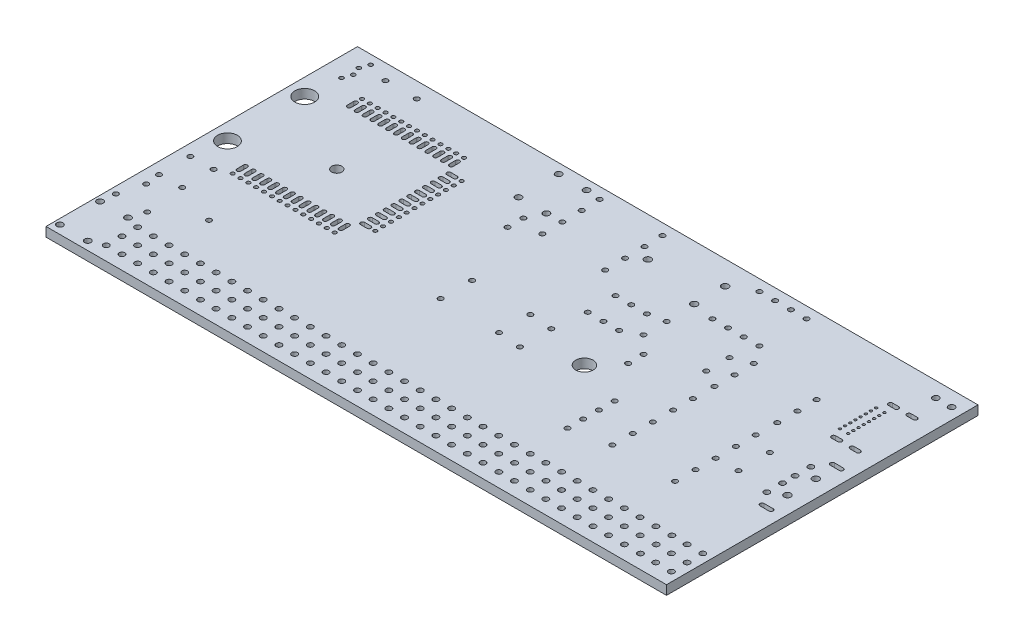
from build123d import *

# Parameters (mm, degrees)
SKETCH1_W           = 100.4
SKETCH1_H           = 50.4
SKETCH1_R           = 1.592180998
SKETCH1_R_2         = 0.203
SKETCH1_R_3         = 0.45
SKETCH1_R_4         = 0.546
SKETCH1_R_5         = 0.406
SKETCH1_R_6         = 1.4
SKETCH1_R_7         = 0.457
SKETCH1_R_8         = 0.508
SKETCH1_R_9         = 0.3
SKETCH1_R_10        = 0.325
SKETCH1_R_11        = 0.82
SKETCH1_R_12        = 0.5
SKETCH1_R_13        = 1.59227426
BOSS_EXTRUDE1_DEPTH = 1.5


with BuildPart() as part:
    # Sketch1 → Boss-Extrude1 (new body)
    with BuildSketch(Plane(origin=(0, 0, 0), x_dir=(1, 0, 0), z_dir=(0, 1, 0))):
        with Locations((51.575, 25.508)):
            Rectangle(SKETCH1_W, SKETCH1_H)
        with Locations((4.091913116, 39.45416383)):
            Circle(SKETCH1_R, mode=Mode.SUBTRACT)
        with Locations((95.301, 42.05)):
            Circle(SKETCH1_R_2, mode=Mode.SUBTRACT)
        with Locations((95.301, 41.212)):
            Circle(SKETCH1_R_2, mode=Mode.SUBTRACT)
        with Locations((95.301, 38.697)):
            Circle(SKETCH1_R_2, mode=Mode.SUBTRACT)
        with Locations((95.301, 37.859)):
            Circle(SKETCH1_R_2, mode=Mode.SUBTRACT)
        with Locations((95.301, 40.373)):
            Circle(SKETCH1_R_2, mode=Mode.SUBTRACT)
        with Locations((95.301, 39.535)):
            Circle(SKETCH1_R_2, mode=Mode.SUBTRACT)
        with Locations((93.955, 42.05)):
            Circle(SKETCH1_R_2, mode=Mode.SUBTRACT)
        with Locations((93.955, 41.212)):
            Circle(SKETCH1_R_2, mode=Mode.SUBTRACT)
        with Locations((93.955, 40.373)):
            Circle(SKETCH1_R_2, mode=Mode.SUBTRACT)
        with Locations((93.955, 37.859)):
            Circle(SKETCH1_R_2, mode=Mode.SUBTRACT)
        with Locations((93.955, 37.02)):
            Circle(SKETCH1_R_2, mode=Mode.SUBTRACT)
        with Locations((93.955, 39.535)):
            Circle(SKETCH1_R_2, mode=Mode.SUBTRACT)
        with Locations((93.955, 38.697)):
            Circle(SKETCH1_R_2, mode=Mode.SUBTRACT)
        with Locations((96.926, 28.499)):
            Circle(SKETCH1_R_3, mode=Mode.SUBTRACT)
        with Locations((95.301, 37.02)):
            Circle(SKETCH1_R_2, mode=Mode.SUBTRACT)
        with Locations((95.301, 36.182)):
            Circle(SKETCH1_R_2, mode=Mode.SUBTRACT)
        with Locations((99.009, 27.229)):
            Circle(SKETCH1_R_4, mode=Mode.SUBTRACT)
        with Locations((99.009, 22.644)):
            Circle(SKETCH1_R_4, mode=Mode.SUBTRACT)
        with Locations((96.926, 25.959)):
            Circle(SKETCH1_R_3, mode=Mode.SUBTRACT)
        with Locations((96.926, 23.927)):
            Circle(SKETCH1_R_3, mode=Mode.SUBTRACT)
        with Locations((93.955, 36.182)):
            Circle(SKETCH1_R_2, mode=Mode.SUBTRACT)
        with Locations((88.036, 35.23)):
            Circle(SKETCH1_R_5, mode=Mode.SUBTRACT)
        with Locations((88.034, 31.965)):
            Circle(SKETCH1_R_5, mode=Mode.SUBTRACT)
        with Locations((91.618, 27.178)):
            Circle(SKETCH1_R_5, mode=Mode.SUBTRACT)
        with Locations((91.618, 22.098)):
            Circle(SKETCH1_R_5, mode=Mode.SUBTRACT)
        with Locations((88.011, 25.298)):
            Circle(SKETCH1_R_5, mode=Mode.SUBTRACT)
        with Locations((88.036, 22.003)):
            Circle(SKETCH1_R_5, mode=Mode.SUBTRACT)
        with Locations((75.844, 48.895)):
            Circle(SKETCH1_R_5, mode=Mode.SUBTRACT)
        with Locations((73.304, 48.895)):
            Circle(SKETCH1_R_5, mode=Mode.SUBTRACT)
        with Locations((75.844, 41.275)):
            Circle(SKETCH1_R_5, mode=Mode.SUBTRACT)
        with Locations((70.764, 48.895)):
            Circle(SKETCH1_R_5, mode=Mode.SUBTRACT)
        with Locations((70.764, 41.275)):
            Circle(SKETCH1_R_5, mode=Mode.SUBTRACT)
        with Locations((77.826, 38.379)):
            Circle(SKETCH1_R_5, mode=Mode.SUBTRACT)
        with Locations((87.986, 38.379)):
            Circle(SKETCH1_R_5, mode=Mode.SUBTRACT)
        with Locations((73.304, 41.275)):
            Circle(SKETCH1_R_5, mode=Mode.SUBTRACT)
        with Locations((75.057, 37.211)):
            Circle(SKETCH1_R_5, mode=Mode.SUBTRACT)
        with Locations((68.224, 48.895)):
            Circle(SKETCH1_R_5, mode=Mode.SUBTRACT)
        with Locations((64.7, 46.874)):
            Circle(SKETCH1_R_4, mode=Mode.SUBTRACT)
        with Locations((54.69, 44.374)):
            Circle(SKETCH1_R_4, mode=Mode.SUBTRACT)
        with Locations((64.68, 41.874)):
            Circle(SKETCH1_R_4, mode=Mode.SUBTRACT)
        with Locations((68.224, 41.275)):
            Circle(SKETCH1_R_5, mode=Mode.SUBTRACT)
        with Locations((64.897, 37.211)):
            Circle(SKETCH1_R_5, mode=Mode.SUBTRACT)
        with Locations((59.69, 36.678)):
            Circle(SKETCH1_R_5, mode=Mode.SUBTRACT)
        with Locations((62.23, 36.678)):
            Circle(SKETCH1_R_5, mode=Mode.SUBTRACT)
        with Locations((77.876, 35.23)):
            Circle(SKETCH1_R_5, mode=Mode.SUBTRACT)
        with Locations((77.874, 31.965)):
            Circle(SKETCH1_R_5, mode=Mode.SUBTRACT)
        with Locations((88.001, 28.512)):
            Circle(SKETCH1_R_5, mode=Mode.SUBTRACT)
        with Locations((75.057, 33.452)):
            Circle(SKETCH1_R_5, mode=Mode.SUBTRACT)
        with Locations((77.841, 28.512)):
            Circle(SKETCH1_R_5, mode=Mode.SUBTRACT)
        with Locations((77.851, 25.298)):
            Circle(SKETCH1_R_5, mode=Mode.SUBTRACT)
        with Locations((77.876, 22.003)):
            Circle(SKETCH1_R_5, mode=Mode.SUBTRACT)
        with Locations((67.666, 28.194)):
            Circle(SKETCH1_R_5, mode=Mode.SUBTRACT)
        with Locations((71.832, 21.846)):
            Circle(SKETCH1_R_5, mode=Mode.SUBTRACT)
        with Locations((64.897, 33.452)):
            Circle(SKETCH1_R_5, mode=Mode.SUBTRACT)
        with Locations((62.306, 32.106)):
            Circle(SKETCH1_R_5, mode=Mode.SUBTRACT)
        with Locations((57.15, 36.678)):
            Circle(SKETCH1_R_5, mode=Mode.SUBTRACT)
        with Locations((59.766, 32.106)):
            Circle(SKETCH1_R_5, mode=Mode.SUBTRACT)
        with Locations((67.64, 30.734)):
            Circle(SKETCH1_R_5, mode=Mode.SUBTRACT)
        with Locations((64.364, 24.435)):
            Circle(SKETCH1_R_6, mode=Mode.SUBTRACT)
        with Locations((57.226, 32.106)):
            Circle(SKETCH1_R_5, mode=Mode.SUBTRACT)
        with Locations((56.591, 26.848)):
            Circle(SKETCH1_R_5, mode=Mode.SUBTRACT)
        with Locations((96.926, 21.387)):
            Circle(SKETCH1_R_3, mode=Mode.SUBTRACT)
        with Locations((95.301, 7.645)):
            Circle(SKETCH1_R_7, mode=Mode.SUBTRACT)
        with Locations((88.011, 18.771)):
            Circle(SKETCH1_R_5, mode=Mode.SUBTRACT)
        with Locations((90.17, 7.62)):
            Circle(SKETCH1_R_7, mode=Mode.SUBTRACT)
        with Locations((97.79, 7.62)):
            Circle(SKETCH1_R_7, mode=Mode.SUBTRACT)
        with Locations((100.33, 7.62)):
            Circle(SKETCH1_R_7, mode=Mode.SUBTRACT)
        with Locations((92.735, 7.62)):
            Circle(SKETCH1_R_7, mode=Mode.SUBTRACT)
        with Locations((95.301, 5.105)):
            Circle(SKETCH1_R_7, mode=Mode.SUBTRACT)
        with Locations((77.851, 18.771)):
            Circle(SKETCH1_R_5, mode=Mode.SUBTRACT)
        with Locations((87.981, 15.489)):
            Circle(SKETCH1_R_5, mode=Mode.SUBTRACT)
        with Locations((77.821, 15.489)):
            Circle(SKETCH1_R_5, mode=Mode.SUBTRACT)
        with Locations((77.47, 7.645)):
            Circle(SKETCH1_R_7, mode=Mode.SUBTRACT)
        with Locations((85.09, 7.62)):
            Circle(SKETCH1_R_7, mode=Mode.SUBTRACT)
        with Locations((87.63, 7.62)):
            Circle(SKETCH1_R_7, mode=Mode.SUBTRACT)
        with Locations((80.01, 7.62)):
            Circle(SKETCH1_R_7, mode=Mode.SUBTRACT)
        with Locations((82.55, 7.62)):
            Circle(SKETCH1_R_7, mode=Mode.SUBTRACT)
        with Locations((100.33, 5.08)):
            Circle(SKETCH1_R_7, mode=Mode.SUBTRACT)
        with Locations((97.79, 5.08)):
            Circle(SKETCH1_R_7, mode=Mode.SUBTRACT)
        with Locations((95.301, 2.565)):
            Circle(SKETCH1_R_7, mode=Mode.SUBTRACT)
        with Locations((90.17, 5.08)):
            Circle(SKETCH1_R_7, mode=Mode.SUBTRACT)
        with Locations((92.735, 5.08)):
            Circle(SKETCH1_R_7, mode=Mode.SUBTRACT)
        with Locations((97.79, 2.54)):
            Circle(SKETCH1_R_7, mode=Mode.SUBTRACT)
        with Locations((100.33, 2.54)):
            Circle(SKETCH1_R_7, mode=Mode.SUBTRACT)
        with Locations((90.17, 2.54)):
            Circle(SKETCH1_R_7, mode=Mode.SUBTRACT)
        with Locations((92.735, 2.54)):
            Circle(SKETCH1_R_7, mode=Mode.SUBTRACT)
        with Locations((85.09, 5.08)):
            Circle(SKETCH1_R_7, mode=Mode.SUBTRACT)
        with Locations((87.63, 5.08)):
            Circle(SKETCH1_R_7, mode=Mode.SUBTRACT)
        with Locations((80.01, 5.08)):
            Circle(SKETCH1_R_7, mode=Mode.SUBTRACT)
        with Locations((82.55, 5.08)):
            Circle(SKETCH1_R_7, mode=Mode.SUBTRACT)
        with Locations((85.09, 2.54)):
            Circle(SKETCH1_R_7, mode=Mode.SUBTRACT)
        with Locations((87.63, 2.54)):
            Circle(SKETCH1_R_7, mode=Mode.SUBTRACT)
        with Locations((80.01, 2.54)):
            Circle(SKETCH1_R_7, mode=Mode.SUBTRACT)
        with Locations((82.55, 2.54)):
            Circle(SKETCH1_R_7, mode=Mode.SUBTRACT)
        with Locations((72.415, 7.62)):
            Circle(SKETCH1_R_7, mode=Mode.SUBTRACT)
        with Locations((71.832, 14.226)):
            Circle(SKETCH1_R_5, mode=Mode.SUBTRACT)
        with Locations((74.93, 7.62)):
            Circle(SKETCH1_R_7, mode=Mode.SUBTRACT)
        with Locations((71.832, 19.306)):
            Circle(SKETCH1_R_5, mode=Mode.SUBTRACT)
        with Locations((71.832, 16.766)):
            Circle(SKETCH1_R_5, mode=Mode.SUBTRACT)
        with Locations((77.47, 5.105)):
            Circle(SKETCH1_R_7, mode=Mode.SUBTRACT)
        with Locations((72.415, 5.08)):
            Circle(SKETCH1_R_7, mode=Mode.SUBTRACT)
        with Locations((69.85, 7.62)):
            Circle(SKETCH1_R_7, mode=Mode.SUBTRACT)
        with Locations((69.85, 5.08)):
            Circle(SKETCH1_R_7, mode=Mode.SUBTRACT)
        with Locations((64.77, 7.62)):
            Circle(SKETCH1_R_7, mode=Mode.SUBTRACT)
        with Locations((67.31, 7.62)):
            Circle(SKETCH1_R_7, mode=Mode.SUBTRACT)
        with Locations((56.591, 21.768)):
            Circle(SKETCH1_R_5, mode=Mode.SUBTRACT)
        with Locations((62.23, 7.62)):
            Circle(SKETCH1_R_7, mode=Mode.SUBTRACT)
        with Locations((59.69, 7.62)):
            Circle(SKETCH1_R_7, mode=Mode.SUBTRACT)
        with Locations((67.31, 5.08)):
            Circle(SKETCH1_R_7, mode=Mode.SUBTRACT)
        with Locations((54.61, 7.62)):
            Circle(SKETCH1_R_7, mode=Mode.SUBTRACT)
        with Locations((57.15, 7.62)):
            Circle(SKETCH1_R_7, mode=Mode.SUBTRACT)
        with Locations((74.93, 5.08)):
            Circle(SKETCH1_R_7, mode=Mode.SUBTRACT)
        with Locations((77.47, 2.565)):
            Circle(SKETCH1_R_7, mode=Mode.SUBTRACT)
        with Locations((64.77, 5.08)):
            Circle(SKETCH1_R_7, mode=Mode.SUBTRACT)
        with Locations((74.93, 2.54)):
            Circle(SKETCH1_R_7, mode=Mode.SUBTRACT)
        with Locations((69.85, 2.54)):
            Circle(SKETCH1_R_7, mode=Mode.SUBTRACT)
        with Locations((72.415, 2.54)):
            Circle(SKETCH1_R_7, mode=Mode.SUBTRACT)
        with Locations((64.77, 2.54)):
            Circle(SKETCH1_R_7, mode=Mode.SUBTRACT)
        with Locations((67.31, 2.54)):
            Circle(SKETCH1_R_7, mode=Mode.SUBTRACT)
        with Locations((59.69, 5.08)):
            Circle(SKETCH1_R_7, mode=Mode.SUBTRACT)
        with Locations((62.23, 5.08)):
            Circle(SKETCH1_R_7, mode=Mode.SUBTRACT)
        with Locations((54.61, 5.08)):
            Circle(SKETCH1_R_7, mode=Mode.SUBTRACT)
        with Locations((57.15, 5.08)):
            Circle(SKETCH1_R_7, mode=Mode.SUBTRACT)
        with Locations((59.69, 2.54)):
            Circle(SKETCH1_R_7, mode=Mode.SUBTRACT)
        with Locations((62.23, 2.54)):
            Circle(SKETCH1_R_7, mode=Mode.SUBTRACT)
        with Locations((54.61, 2.54)):
            Circle(SKETCH1_R_7, mode=Mode.SUBTRACT)
        with Locations((57.15, 2.54)):
            Circle(SKETCH1_R_7, mode=Mode.SUBTRACT)
        with Locations((52.629, 45.898)):
            Circle(SKETCH1_R_5, mode=Mode.SUBTRACT)
        with Locations((52.527, 48.895)):
            Circle(SKETCH1_R_5, mode=Mode.SUBTRACT)
        with Locations((42.469, 45.898)):
            Circle(SKETCH1_R_5, mode=Mode.SUBTRACT)
        with Locations((40.03, 49.124)):
            Circle(SKETCH1_R_8, mode=Mode.SUBTRACT)
        with Locations((42.367, 48.895)):
            Circle(SKETCH1_R_5, mode=Mode.SUBTRACT)
        with Locations((52.68, 42.697)):
            Circle(SKETCH1_R_5, mode=Mode.SUBTRACT)
        with Locations((52.73, 39.421)):
            Circle(SKETCH1_R_5, mode=Mode.SUBTRACT)
        with Locations((42.52, 42.697)):
            Circle(SKETCH1_R_5, mode=Mode.SUBTRACT)
        with Locations((42.57, 39.421)):
            Circle(SKETCH1_R_5, mode=Mode.SUBTRACT)
        with Locations((35.509, 49.124)):
            Circle(SKETCH1_R_8, mode=Mode.SUBTRACT)
        with Locations((40.03, 42.621)):
            Circle(SKETCH1_R_8, mode=Mode.SUBTRACT)
        with Locations((24.311, 43.739)):
            Circle(SKETCH1_R_9, mode=Mode.SUBTRACT)
        with Locations((25.581, 43.739)):
            Circle(SKETCH1_R_9, mode=Mode.SUBTRACT)
        with Locations((35.509, 42.621)):
            Circle(SKETCH1_R_8, mode=Mode.SUBTRACT)
        with Locations((38.837, 40.081)):
            Circle(SKETCH1_R_5, mode=Mode.SUBTRACT)
        with Locations((28.626, 40.304)):
            Circle(SKETCH1_R_9, mode=Mode.SUBTRACT)
        with Locations((28.626, 39.034)):
            Circle(SKETCH1_R_9, mode=Mode.SUBTRACT)
        with Locations((38.837, 37.541)):
            Circle(SKETCH1_R_5, mode=Mode.SUBTRACT)
        with Locations((28.626, 36.494)):
            Circle(SKETCH1_R_9, mode=Mode.SUBTRACT)
        with Locations((28.626, 35.224)):
            Circle(SKETCH1_R_9, mode=Mode.SUBTRACT)
        with Locations((28.626, 33.954)):
            Circle(SKETCH1_R_9, mode=Mode.SUBTRACT)
        with Locations((28.626, 32.684)):
            Circle(SKETCH1_R_9, mode=Mode.SUBTRACT)
        with Locations((43.409, 27.203)):
            Circle(SKETCH1_R_5, mode=Mode.SUBTRACT)
        with Locations((52.908, 27.153)):
            Circle(SKETCH1_R_5, mode=Mode.SUBTRACT)
        with Locations((28.626, 31.414)):
            Circle(SKETCH1_R_9, mode=Mode.SUBTRACT)
        with Locations((43.409, 22.123)):
            Circle(SKETCH1_R_5, mode=Mode.SUBTRACT)
        with Locations((28.626, 28.874)):
            Circle(SKETCH1_R_9, mode=Mode.SUBTRACT)
        with Locations((28.626, 27.604)):
            Circle(SKETCH1_R_9, mode=Mode.SUBTRACT)
        with Locations((28.626, 37.764)):
            Circle(SKETCH1_R_9, mode=Mode.SUBTRACT)
        with Locations((28.626, 30.144)):
            Circle(SKETCH1_R_9, mode=Mode.SUBTRACT)
        with Locations((28.626, 26.334)):
            Circle(SKETCH1_R_9, mode=Mode.SUBTRACT)
        with Locations((25.581, 22.809)):
            Circle(SKETCH1_R_9, mode=Mode.SUBTRACT)
        with Locations((23.041, 22.809)):
            Circle(SKETCH1_R_9, mode=Mode.SUBTRACT)
        with Locations((24.311, 22.809)):
            Circle(SKETCH1_R_9, mode=Mode.SUBTRACT)
        with Locations((16.691, 43.739)):
            Circle(SKETCH1_R_9, mode=Mode.SUBTRACT)
        with Locations((15.421, 43.739)):
            Circle(SKETCH1_R_9, mode=Mode.SUBTRACT)
        with Locations((17.961, 43.739)):
            Circle(SKETCH1_R_9, mode=Mode.SUBTRACT)
        with Locations((13.487, 48.184)):
            Circle(SKETCH1_R_5, mode=Mode.SUBTRACT)
        with Locations((14.151, 43.739)):
            Circle(SKETCH1_R_9, mode=Mode.SUBTRACT)
        with Locations((21.771, 43.739)):
            Circle(SKETCH1_R_9, mode=Mode.SUBTRACT)
        with Locations((23.041, 43.739)):
            Circle(SKETCH1_R_9, mode=Mode.SUBTRACT)
        with Locations((19.231, 43.739)):
            Circle(SKETCH1_R_9, mode=Mode.SUBTRACT)
        with Locations((20.501, 43.739)):
            Circle(SKETCH1_R_9, mode=Mode.SUBTRACT)
        with Locations((4.98, 49.219)):
            Circle(SKETCH1_R_10, mode=Mode.SUBTRACT)
        with Locations((8.407, 48.184)):
            Circle(SKETCH1_R_5, mode=Mode.SUBTRACT)
        with Locations((4.472, 47.822)):
            Circle(SKETCH1_R_10, mode=Mode.SUBTRACT)
        with Locations((4.98, 46.425)):
            Circle(SKETCH1_R_10, mode=Mode.SUBTRACT)
        with Locations((11.611, 43.739)):
            Circle(SKETCH1_R_9, mode=Mode.SUBTRACT)
        with Locations((12.881, 43.739)):
            Circle(SKETCH1_R_9, mode=Mode.SUBTRACT)
        with Locations((4.472, 45.028)):
            Circle(SKETCH1_R_10, mode=Mode.SUBTRACT)
        with Locations((9.071, 43.739)):
            Circle(SKETCH1_R_9, mode=Mode.SUBTRACT)
        with Locations((20.501, 22.809)):
            Circle(SKETCH1_R_9, mode=Mode.SUBTRACT)
        with Locations((19.231, 22.809)):
            Circle(SKETCH1_R_9, mode=Mode.SUBTRACT)
        with Locations((21.771, 22.809)):
            Circle(SKETCH1_R_9, mode=Mode.SUBTRACT)
        with Locations((16.871, 31.862)):
            Circle(SKETCH1_R_11, mode=Mode.SUBTRACT)
        with Locations((17.961, 22.809)):
            Circle(SKETCH1_R_9, mode=Mode.SUBTRACT)
        with Locations((15.421, 22.809)):
            Circle(SKETCH1_R_9, mode=Mode.SUBTRACT)
        with Locations((16.691, 22.809)):
            Circle(SKETCH1_R_9, mode=Mode.SUBTRACT)
        with Locations((12.881, 22.809)):
            Circle(SKETCH1_R_9, mode=Mode.SUBTRACT)
        with Locations((14.151, 22.809)):
            Circle(SKETCH1_R_9, mode=Mode.SUBTRACT)
        with Locations((10.341, 43.739)):
            Circle(SKETCH1_R_9, mode=Mode.SUBTRACT)
        with Locations((21.59, 5.08)):
            Circle(SKETCH1_R_7, mode=Mode.SUBTRACT)
        with Locations((24.13, 5.08)):
            Circle(SKETCH1_R_7, mode=Mode.SUBTRACT)
        with Locations((16.51, 5.08)):
            Circle(SKETCH1_R_7, mode=Mode.SUBTRACT)
        with Locations((19.05, 5.08)):
            Circle(SKETCH1_R_7, mode=Mode.SUBTRACT)
        with Locations((21.59, 2.54)):
            Circle(SKETCH1_R_7, mode=Mode.SUBTRACT)
        with Locations((24.13, 2.54)):
            Circle(SKETCH1_R_7, mode=Mode.SUBTRACT)
        with Locations((16.51, 2.54)):
            Circle(SKETCH1_R_7, mode=Mode.SUBTRACT)
        with Locations((19.05, 2.54)):
            Circle(SKETCH1_R_7, mode=Mode.SUBTRACT)
        with Locations((13.97, 5.08)):
            Circle(SKETCH1_R_7, mode=Mode.SUBTRACT)
        with Locations((13.97, 2.54)):
            Circle(SKETCH1_R_7, mode=Mode.SUBTRACT)
        with Locations((8.89, 5.08)):
            Circle(SKETCH1_R_7, mode=Mode.SUBTRACT)
        with Locations((11.43, 5.08)):
            Circle(SKETCH1_R_7, mode=Mode.SUBTRACT)
        with Locations((8.89, 2.54)):
            Circle(SKETCH1_R_7, mode=Mode.SUBTRACT)
        with Locations((11.43, 2.54)):
            Circle(SKETCH1_R_7, mode=Mode.SUBTRACT)
        with Locations((2.247, 1.676)):
            Circle(SKETCH1_R_8, mode=Mode.SUBTRACT)
        with Locations((6.768, 1.676)):
            Circle(SKETCH1_R_8, mode=Mode.SUBTRACT)
        with Locations((3.251, 21.793)):
            Circle(SKETCH1_R_5, mode=Mode.SUBTRACT)
        with Locations((3.251, 16.713)):
            Circle(SKETCH1_R_5, mode=Mode.SUBTRACT)
        with Locations((3.531, 14.351)):
            Circle(SKETCH1_R_5, mode=Mode.SUBTRACT)
        with Locations((6.768, 8.179)):
            Circle(SKETCH1_R_8, mode=Mode.SUBTRACT)
        with Locations((2.464, 10.516)):
            Circle(SKETCH1_R_5, mode=Mode.SUBTRACT)
        with Locations((2.247, 8.179)):
            Circle(SKETCH1_R_8, mode=Mode.SUBTRACT)
        with Locations((24.13, 7.62)):
            Circle(SKETCH1_R_7, mode=Mode.SUBTRACT)
        with Locations((13.691, 14.351)):
            Circle(SKETCH1_R_5, mode=Mode.SUBTRACT)
        with Locations((7.544, 10.516)):
            Circle(SKETCH1_R_5, mode=Mode.SUBTRACT)
        with Locations((13.97, 7.62)):
            Circle(SKETCH1_R_7, mode=Mode.SUBTRACT)
        with Locations((16.51, 7.62)):
            Circle(SKETCH1_R_7, mode=Mode.SUBTRACT)
        with Locations((8.89, 7.62)):
            Circle(SKETCH1_R_7, mode=Mode.SUBTRACT)
        with Locations((11.43, 7.62)):
            Circle(SKETCH1_R_7, mode=Mode.SUBTRACT)
        with Locations((6.934, 21.869)):
            Circle(SKETCH1_R_5, mode=Mode.SUBTRACT)
        with Locations((6.934, 16.789)):
            Circle(SKETCH1_R_5, mode=Mode.SUBTRACT)
        with Locations((49.53, 5.08)):
            Circle(SKETCH1_R_7, mode=Mode.SUBTRACT)
        with Locations((52.07, 5.08)):
            Circle(SKETCH1_R_7, mode=Mode.SUBTRACT)
        with Locations((44.45, 7.62)):
            Circle(SKETCH1_R_7, mode=Mode.SUBTRACT)
        with Locations((46.99, 5.08)):
            Circle(SKETCH1_R_7, mode=Mode.SUBTRACT)
        with Locations((36.83, 7.62)):
            Circle(SKETCH1_R_7, mode=Mode.SUBTRACT)
        with Locations((39.37, 7.62)):
            Circle(SKETCH1_R_7, mode=Mode.SUBTRACT)
        with Locations((26.67, 7.62)):
            Circle(SKETCH1_R_7, mode=Mode.SUBTRACT)
        with Locations((34.29, 7.62)):
            Circle(SKETCH1_R_7, mode=Mode.SUBTRACT)
        with Locations((39.37, 5.08)):
            Circle(SKETCH1_R_7, mode=Mode.SUBTRACT)
        with Locations((41.91, 5.08)):
            Circle(SKETCH1_R_7, mode=Mode.SUBTRACT)
        with Locations((29.21, 7.62)):
            Circle(SKETCH1_R_7, mode=Mode.SUBTRACT)
        with Locations((31.75, 7.62)):
            Circle(SKETCH1_R_7, mode=Mode.SUBTRACT)
        with Locations((49.53, 2.54)):
            Circle(SKETCH1_R_7, mode=Mode.SUBTRACT)
        with Locations((46.99, 2.54)):
            Circle(SKETCH1_R_7, mode=Mode.SUBTRACT)
        with Locations((52.07, 2.54)):
            Circle(SKETCH1_R_7, mode=Mode.SUBTRACT)
        with Locations((36.83, 5.08)):
            Circle(SKETCH1_R_7, mode=Mode.SUBTRACT)
        with Locations((44.45, 5.08)):
            Circle(SKETCH1_R_7, mode=Mode.SUBTRACT)
        with Locations((41.91, 2.54)):
            Circle(SKETCH1_R_7, mode=Mode.SUBTRACT)
        with Locations((44.45, 2.54)):
            Circle(SKETCH1_R_7, mode=Mode.SUBTRACT)
        with Locations((36.83, 2.54)):
            Circle(SKETCH1_R_7, mode=Mode.SUBTRACT)
        with Locations((39.37, 2.54)):
            Circle(SKETCH1_R_7, mode=Mode.SUBTRACT)
        with Locations((31.75, 5.08)):
            Circle(SKETCH1_R_7, mode=Mode.SUBTRACT)
        with Locations((34.29, 5.08)):
            Circle(SKETCH1_R_7, mode=Mode.SUBTRACT)
        with Locations((26.67, 5.08)):
            Circle(SKETCH1_R_7, mode=Mode.SUBTRACT)
        with Locations((29.21, 5.08)):
            Circle(SKETCH1_R_7, mode=Mode.SUBTRACT)
        with Locations((31.75, 2.54)):
            Circle(SKETCH1_R_7, mode=Mode.SUBTRACT)
        with Locations((34.29, 2.54)):
            Circle(SKETCH1_R_7, mode=Mode.SUBTRACT)
        with Locations((26.67, 2.54)):
            Circle(SKETCH1_R_7, mode=Mode.SUBTRACT)
        with Locations((29.21, 2.54)):
            Circle(SKETCH1_R_7, mode=Mode.SUBTRACT)
        with Locations((21.59, 7.62)):
            Circle(SKETCH1_R_7, mode=Mode.SUBTRACT)
        with Locations((19.05, 7.62)):
            Circle(SKETCH1_R_7, mode=Mode.SUBTRACT)
        with Locations((46.99, 7.62)):
            Circle(SKETCH1_R_7, mode=Mode.SUBTRACT)
        with Locations((41.91, 7.62)):
            Circle(SKETCH1_R_7, mode=Mode.SUBTRACT)
        with Locations((49.53, 7.62)):
            Circle(SKETCH1_R_7, mode=Mode.SUBTRACT)
        with Locations((11.611, 22.809)):
            Circle(SKETCH1_R_9, mode=Mode.SUBTRACT)
        with Locations((10.341, 22.809)):
            Circle(SKETCH1_R_9, mode=Mode.SUBTRACT)
        with Locations((52.07, 7.62)):
            Circle(SKETCH1_R_7, mode=Mode.SUBTRACT)
        with Locations((97.409, 48.26)):
            Circle(SKETCH1_R_12, mode=Mode.SUBTRACT)
        with Locations((9.071, 22.809)):
            Circle(SKETCH1_R_9, mode=Mode.SUBTRACT)
        with Locations((52.908, 22.073)):
            Circle(SKETCH1_R_5, mode=Mode.SUBTRACT)
        with Locations((99.949, 48.26)):
            Circle(SKETCH1_R_12, mode=Mode.SUBTRACT)
        with Locations((4.07150772, 26.974012322)):
            Circle(SKETCH1_R_13, mode=Mode.SUBTRACT)
        with BuildLine():
            Line((99.7365, 30.295209463), (98.2815, 30.295209463))
            ThreePointArc((98.2815, 30.295209463), (97.944709463, 30.632), (98.2815, 30.968790537))
            Line((98.2815, 30.968790537), (99.7365, 30.968790537))
            ThreePointArc((99.7365, 30.968790537), (100.073290537, 30.632), (99.7365, 30.295209463))
        make_face(mode=Mode.SUBTRACT)
        with BuildLine():
            Line((99.7365, 18.916209463), (98.2815, 18.916209463))
            ThreePointArc((98.2815, 18.916209463), (97.944709463, 19.253), (98.2815, 19.589790537))
            Line((98.2815, 19.589790537), (99.7365, 19.589790537))
            ThreePointArc((99.7365, 19.589790537), (100.073290537, 19.253), (99.7365, 18.916209463))
        make_face(mode=Mode.SUBTRACT)
        with BuildLine():
            Line((98.602, 43.382209463), (97.588, 43.382209463))
            ThreePointArc((97.588, 43.382209463), (97.251209463, 43.719), (97.588, 44.055790537))
            Line((97.588, 44.055790537), (98.602, 44.055790537))
            ThreePointArc((98.602, 44.055790537), (98.938790537, 43.719), (98.602, 43.382209463))
        make_face(mode=Mode.SUBTRACT)
        with BuildLine():
            Line((9.396, 42.714), (9.396, 41.664))
            ThreePointArc((9.396, 41.664), (9.071, 41.339), (8.746, 41.664))
            Line((8.746, 41.664), (8.746, 42.714))
            ThreePointArc((8.746, 42.714), (9.071, 43.039), (9.396, 42.714))
        make_face(mode=Mode.SUBTRACT)
        with BuildLine():
            Line((95.603517713, 43.37709689), (94.589517713, 43.37709689))
            ThreePointArc((94.589517713, 43.37709689), (94.252727176, 43.713887427), (94.589517713, 44.050677964))
            Line((94.589517713, 44.050677964), (95.603517713, 44.050677964))
            ThreePointArc((95.603517713, 44.050677964), (95.94030825, 43.713887427), (95.603517713, 43.37709689))
        make_face(mode=Mode.SUBTRACT)
        with BuildLine():
            Line((98.610049185, 34.178085757), (97.596049185, 34.178085757))
            ThreePointArc((97.596049185, 34.178085757), (97.259258648, 34.514876294), (97.596049185, 34.851666831))
            Line((97.596049185, 34.851666831), (98.610049185, 34.851666831))
            ThreePointArc((98.610049185, 34.851666831), (98.946839722, 34.514876294), (98.610049185, 34.178085757))
        make_face(mode=Mode.SUBTRACT)
        with BuildLine():
            Line((95.597723527, 34.194655205), (94.583723527, 34.194655205))
            ThreePointArc((94.583723527, 34.194655205), (94.246932991, 34.531445742), (94.583723527, 34.868236279))
            Line((94.583723527, 34.868236279), (95.597723527, 34.868236279))
            ThreePointArc((95.597723527, 34.868236279), (95.934514064, 34.531445742), (95.597723527, 34.194655205))
        make_face(mode=Mode.SUBTRACT)
        with BuildLine():
            Line((27.601, 39.979), (26.551, 39.979))
            ThreePointArc((26.551, 39.979), (26.226, 40.304), (26.551, 40.629))
            Line((26.551, 40.629), (27.601, 40.629))
            ThreePointArc((27.601, 40.629), (27.926, 40.304), (27.601, 39.979))
        make_face(mode=Mode.SUBTRACT)
        with BuildLine():
            Line((8.746, 23.834), (8.746, 24.884))
            ThreePointArc((8.746, 24.884), (9.071, 25.209), (9.396, 24.884))
            Line((9.396, 24.884), (9.396, 23.834))
            ThreePointArc((9.396, 23.834), (9.071, 23.509), (8.746, 23.834))
        make_face(mode=Mode.SUBTRACT)
        with BuildLine():
            Line((10.016, 23.834), (10.016, 24.884))
            ThreePointArc((10.016, 24.884), (10.341, 25.209), (10.666, 24.884))
            Line((10.666, 24.884), (10.666, 23.834))
            ThreePointArc((10.666, 23.834), (10.341, 23.509), (10.016, 23.834))
        make_face(mode=Mode.SUBTRACT)
        with BuildLine():
            Line((11.286, 23.834), (11.286, 24.884))
            ThreePointArc((11.286, 24.884), (11.611, 25.209), (11.936, 24.884))
            Line((11.936, 24.884), (11.936, 23.834))
            ThreePointArc((11.936, 23.834), (11.611, 23.509), (11.286, 23.834))
        make_face(mode=Mode.SUBTRACT)
        with BuildLine():
            Line((12.556, 23.834), (12.556, 24.884))
            ThreePointArc((12.556, 24.884), (12.881, 25.209), (13.206, 24.884))
            Line((13.206, 24.884), (13.206, 23.834))
            ThreePointArc((13.206, 23.834), (12.881, 23.509), (12.556, 23.834))
        make_face(mode=Mode.SUBTRACT)
        with BuildLine():
            Line((13.826, 23.834), (13.826, 24.884))
            ThreePointArc((13.826, 24.884), (14.151, 25.209), (14.476, 24.884))
            Line((14.476, 24.884), (14.476, 23.834))
            ThreePointArc((14.476, 23.834), (14.151, 23.509), (13.826, 23.834))
        make_face(mode=Mode.SUBTRACT)
        with BuildLine():
            Line((15.096, 23.834), (15.096, 24.884))
            ThreePointArc((15.096, 24.884), (15.421, 25.209), (15.746, 24.884))
            Line((15.746, 24.884), (15.746, 23.834))
            ThreePointArc((15.746, 23.834), (15.421, 23.509), (15.096, 23.834))
        make_face(mode=Mode.SUBTRACT)
        with BuildLine():
            Line((16.366, 23.834), (16.366, 24.884))
            ThreePointArc((16.366, 24.884), (16.691, 25.209), (17.016, 24.884))
            Line((17.016, 24.884), (17.016, 23.834))
            ThreePointArc((17.016, 23.834), (16.691, 23.509), (16.366, 23.834))
        make_face(mode=Mode.SUBTRACT)
        with BuildLine():
            Line((17.636, 23.834), (17.636, 24.884))
            ThreePointArc((17.636, 24.884), (17.961, 25.209), (18.286, 24.884))
            Line((18.286, 24.884), (18.286, 23.834))
            ThreePointArc((18.286, 23.834), (17.961, 23.509), (17.636, 23.834))
        make_face(mode=Mode.SUBTRACT)
        with BuildLine():
            Line((18.906, 23.834), (18.906, 24.884))
            ThreePointArc((18.906, 24.884), (19.231, 25.209), (19.556, 24.884))
            Line((19.556, 24.884), (19.556, 23.834))
            ThreePointArc((19.556, 23.834), (19.231, 23.509), (18.906, 23.834))
        make_face(mode=Mode.SUBTRACT)
        with BuildLine():
            Line((20.176, 23.834), (20.176, 24.884))
            ThreePointArc((20.176, 24.884), (20.501, 25.209), (20.826, 24.884))
            Line((20.826, 24.884), (20.826, 23.834))
            ThreePointArc((20.826, 23.834), (20.501, 23.509), (20.176, 23.834))
        make_face(mode=Mode.SUBTRACT)
        with BuildLine():
            Line((21.446, 23.834), (21.446, 24.884))
            ThreePointArc((21.446, 24.884), (21.771, 25.209), (22.096, 24.884))
            Line((22.096, 24.884), (22.096, 23.834))
            ThreePointArc((22.096, 23.834), (21.771, 23.509), (21.446, 23.834))
        make_face(mode=Mode.SUBTRACT)
        with BuildLine():
            Line((22.716, 23.834), (22.716, 24.884))
            ThreePointArc((22.716, 24.884), (23.041, 25.209), (23.366, 24.884))
            Line((23.366, 24.884), (23.366, 23.834))
            ThreePointArc((23.366, 23.834), (23.041, 23.509), (22.716, 23.834))
        make_face(mode=Mode.SUBTRACT)
        with BuildLine():
            Line((23.986, 23.834), (23.986, 24.884))
            ThreePointArc((23.986, 24.884), (24.311, 25.209), (24.636, 24.884))
            Line((24.636, 24.884), (24.636, 23.834))
            ThreePointArc((24.636, 23.834), (24.311, 23.509), (23.986, 23.834))
        make_face(mode=Mode.SUBTRACT)
        with BuildLine():
            Line((25.256, 23.834), (25.256, 24.884))
            ThreePointArc((25.256, 24.884), (25.581, 25.209), (25.906, 24.884))
            Line((25.906, 24.884), (25.906, 23.834))
            ThreePointArc((25.906, 23.834), (25.581, 23.509), (25.256, 23.834))
        make_face(mode=Mode.SUBTRACT)
        with BuildLine():
            Line((10.666, 42.714), (10.666, 41.664))
            ThreePointArc((10.666, 41.664), (10.341, 41.339), (10.016, 41.664))
            Line((10.016, 41.664), (10.016, 42.714))
            ThreePointArc((10.016, 42.714), (10.341, 43.039), (10.666, 42.714))
        make_face(mode=Mode.SUBTRACT)
        with BuildLine():
            Line((11.936, 42.714), (11.936, 41.664))
            ThreePointArc((11.936, 41.664), (11.611, 41.339), (11.286, 41.664))
            Line((11.286, 41.664), (11.286, 42.714))
            ThreePointArc((11.286, 42.714), (11.611, 43.039), (11.936, 42.714))
        make_face(mode=Mode.SUBTRACT)
        with BuildLine():
            Line((13.206, 42.714), (13.206, 41.664))
            ThreePointArc((13.206, 41.664), (12.881, 41.339), (12.556, 41.664))
            Line((12.556, 41.664), (12.556, 42.714))
            ThreePointArc((12.556, 42.714), (12.881, 43.039), (13.206, 42.714))
        make_face(mode=Mode.SUBTRACT)
        with BuildLine():
            Line((14.476, 42.714), (14.476, 41.664))
            ThreePointArc((14.476, 41.664), (14.151, 41.339), (13.826, 41.664))
            Line((13.826, 41.664), (13.826, 42.714))
            ThreePointArc((13.826, 42.714), (14.151, 43.039), (14.476, 42.714))
        make_face(mode=Mode.SUBTRACT)
        with BuildLine():
            Line((15.746, 42.714), (15.746, 41.664))
            ThreePointArc((15.746, 41.664), (15.421, 41.339), (15.096, 41.664))
            Line((15.096, 41.664), (15.096, 42.714))
            ThreePointArc((15.096, 42.714), (15.421, 43.039), (15.746, 42.714))
        make_face(mode=Mode.SUBTRACT)
        with BuildLine():
            Line((17.016, 42.714), (17.016, 41.664))
            ThreePointArc((17.016, 41.664), (16.691, 41.339), (16.366, 41.664))
            Line((16.366, 41.664), (16.366, 42.714))
            ThreePointArc((16.366, 42.714), (16.691, 43.039), (17.016, 42.714))
        make_face(mode=Mode.SUBTRACT)
        with BuildLine():
            Line((18.286, 42.714), (18.286, 41.664))
            ThreePointArc((18.286, 41.664), (17.961, 41.339), (17.636, 41.664))
            Line((17.636, 41.664), (17.636, 42.714))
            ThreePointArc((17.636, 42.714), (17.961, 43.039), (18.286, 42.714))
        make_face(mode=Mode.SUBTRACT)
        with BuildLine():
            Line((19.556, 42.714), (19.556, 41.664))
            ThreePointArc((19.556, 41.664), (19.231, 41.339), (18.906, 41.664))
            Line((18.906, 41.664), (18.906, 42.714))
            ThreePointArc((18.906, 42.714), (19.231, 43.039), (19.556, 42.714))
        make_face(mode=Mode.SUBTRACT)
        with BuildLine():
            Line((20.826, 42.714), (20.826, 41.664))
            ThreePointArc((20.826, 41.664), (20.501, 41.339), (20.176, 41.664))
            Line((20.176, 41.664), (20.176, 42.714))
            ThreePointArc((20.176, 42.714), (20.501, 43.039), (20.826, 42.714))
        make_face(mode=Mode.SUBTRACT)
        with BuildLine():
            Line((22.096, 42.714), (22.096, 41.664))
            ThreePointArc((22.096, 41.664), (21.771, 41.339), (21.446, 41.664))
            Line((21.446, 41.664), (21.446, 42.714))
            ThreePointArc((21.446, 42.714), (21.771, 43.039), (22.096, 42.714))
        make_face(mode=Mode.SUBTRACT)
        with BuildLine():
            Line((23.366, 42.714), (23.366, 41.664))
            ThreePointArc((23.366, 41.664), (23.041, 41.339), (22.716, 41.664))
            Line((22.716, 41.664), (22.716, 42.714))
            ThreePointArc((22.716, 42.714), (23.041, 43.039), (23.366, 42.714))
        make_face(mode=Mode.SUBTRACT)
        with BuildLine():
            Line((24.636, 42.714), (24.636, 41.664))
            ThreePointArc((24.636, 41.664), (24.311, 41.339), (23.986, 41.664))
            Line((23.986, 41.664), (23.986, 42.714))
            ThreePointArc((23.986, 42.714), (24.311, 43.039), (24.636, 42.714))
        make_face(mode=Mode.SUBTRACT)
        with BuildLine():
            Line((25.906, 42.714), (25.906, 41.664))
            ThreePointArc((25.906, 41.664), (25.581, 41.339), (25.256, 41.664))
            Line((25.256, 41.664), (25.256, 42.714))
            ThreePointArc((25.256, 42.714), (25.581, 43.039), (25.906, 42.714))
        make_face(mode=Mode.SUBTRACT)
        with BuildLine():
            Line((27.601, 38.709), (26.551, 38.709))
            ThreePointArc((26.551, 38.709), (26.226, 39.034), (26.551, 39.359))
            Line((26.551, 39.359), (27.601, 39.359))
            ThreePointArc((27.601, 39.359), (27.926, 39.034), (27.601, 38.709))
        make_face(mode=Mode.SUBTRACT)
        with BuildLine():
            Line((27.601, 37.439), (26.551, 37.439))
            ThreePointArc((26.551, 37.439), (26.226, 37.764), (26.551, 38.089))
            Line((26.551, 38.089), (27.601, 38.089))
            ThreePointArc((27.601, 38.089), (27.926, 37.764), (27.601, 37.439))
        make_face(mode=Mode.SUBTRACT)
        with BuildLine():
            Line((27.601, 36.169), (26.551, 36.169))
            ThreePointArc((26.551, 36.169), (26.226, 36.494), (26.551, 36.819))
            Line((26.551, 36.819), (27.601, 36.819))
            ThreePointArc((27.601, 36.819), (27.926, 36.494), (27.601, 36.169))
        make_face(mode=Mode.SUBTRACT)
        with BuildLine():
            Line((27.601, 34.899), (26.551, 34.899))
            ThreePointArc((26.551, 34.899), (26.226, 35.224), (26.551, 35.549))
            Line((26.551, 35.549), (27.601, 35.549))
            ThreePointArc((27.601, 35.549), (27.926, 35.224), (27.601, 34.899))
        make_face(mode=Mode.SUBTRACT)
        with BuildLine():
            Line((27.601, 33.629), (26.551, 33.629))
            ThreePointArc((26.551, 33.629), (26.226, 33.954), (26.551, 34.279))
            Line((26.551, 34.279), (27.601, 34.279))
            ThreePointArc((27.601, 34.279), (27.926, 33.954), (27.601, 33.629))
        make_face(mode=Mode.SUBTRACT)
        with BuildLine():
            Line((27.601, 32.359), (26.551, 32.359))
            ThreePointArc((26.551, 32.359), (26.226, 32.684), (26.551, 33.009))
            Line((26.551, 33.009), (27.601, 33.009))
            ThreePointArc((27.601, 33.009), (27.926, 32.684), (27.601, 32.359))
        make_face(mode=Mode.SUBTRACT)
        with BuildLine():
            Line((27.601, 31.089), (26.551, 31.089))
            ThreePointArc((26.551, 31.089), (26.226, 31.414), (26.551, 31.739))
            Line((26.551, 31.739), (27.601, 31.739))
            ThreePointArc((27.601, 31.739), (27.926, 31.414), (27.601, 31.089))
        make_face(mode=Mode.SUBTRACT)
        with BuildLine():
            Line((27.601, 29.819), (26.551, 29.819))
            ThreePointArc((26.551, 29.819), (26.226, 30.144), (26.551, 30.469))
            Line((26.551, 30.469), (27.601, 30.469))
            ThreePointArc((27.601, 30.469), (27.926, 30.144), (27.601, 29.819))
        make_face(mode=Mode.SUBTRACT)
        with BuildLine():
            Line((27.601, 28.549), (26.551, 28.549))
            ThreePointArc((26.551, 28.549), (26.226, 28.874), (26.551, 29.199))
            Line((26.551, 29.199), (27.601, 29.199))
            ThreePointArc((27.601, 29.199), (27.926, 28.874), (27.601, 28.549))
        make_face(mode=Mode.SUBTRACT)
        with BuildLine():
            Line((27.601, 27.279), (26.551, 27.279))
            ThreePointArc((26.551, 27.279), (26.226, 27.604), (26.551, 27.929))
            Line((26.551, 27.929), (27.601, 27.929))
            ThreePointArc((27.601, 27.929), (27.926, 27.604), (27.601, 27.279))
        make_face(mode=Mode.SUBTRACT)
        with BuildLine():
            Line((27.601, 26.009), (26.551, 26.009))
            ThreePointArc((26.551, 26.009), (26.226, 26.334), (26.551, 26.659))
            Line((26.551, 26.659), (27.601, 26.659))
            ThreePointArc((27.601, 26.659), (27.926, 26.334), (27.601, 26.009))
        make_face(mode=Mode.SUBTRACT)
    extrude(amount=BOSS_EXTRUDE1_DEPTH)


solid = part.part
